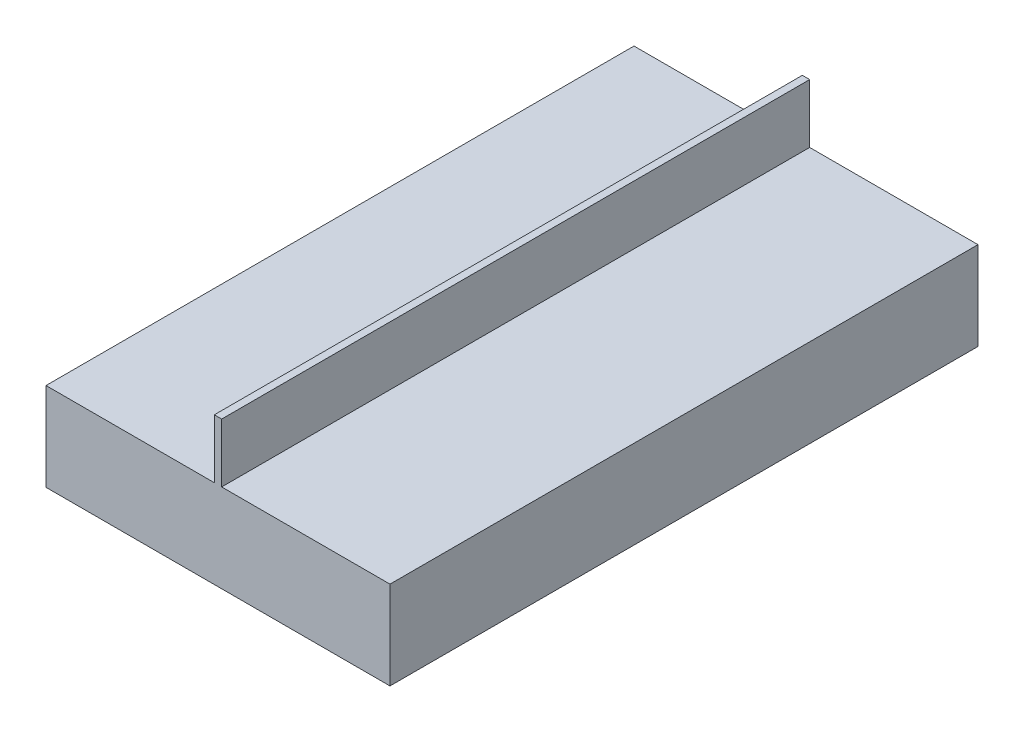
from build123d import *
from build123d.topology import SkipClean

# Parameters (mm, degrees)
BOSS_EXTRUDE1_DEPTH = 40
SKETCH2_R           = 1.5
CUT_EXTRUDE2_DEPTH  = 5
THREAD1_PITCH       = 0.8


with BuildPart() as part:
    # Sketch1 → Boss-Extrude1 (new body)
    with BuildSketch(Plane.XY):
        Polygon((-11.7, 3), (-0.25, 3), (-0.25, 7), (0.25, 7), (0.25, 3), (11.7, 3), (11.7, -3), (-11.7, -3), align=None)
    extrude(amount=BOSS_EXTRUDE1_DEPTH)

    # Sketch2 → Cut-Extrude2 (cut)
    with BuildSketch(Plane(origin=(0, 0, 0), x_dir=(-1, 0, 0), z_dir=(0, 0, -1))):
        Circle(SKETCH2_R)
    extrude(amount=-CUT_EXTRUDE2_DEPTH, mode=Mode.SUBTRACT)

    # Thread1: the profile of Thread Profile1 profile screwed along a right-hand helix of 8.75 turns, 8 arcs to a turn; built about Z, then put on its axis
    with SkipClean():  # the faces are left unmerged after this step: merging them gives an invalid solid
        thread1_z = Axis((0, 0, 0), (0, 0, 1))
        thread1_corners = [(1.4997, 0, -0.000173205), (1.9330127, 0, 0.249999999), (1.9330127, 0, 0.349999999), (1.4997, 0, 0.600173203)]
        with BuildLine(mode=Mode.PRIVATE) as thread1_profile:
            Line(thread1_corners[0], thread1_corners[1])
            Line(thread1_corners[1], thread1_corners[2])
            Line(thread1_corners[2], thread1_corners[3])
            Line(thread1_corners[3], thread1_corners[0])
        thread1_cap = Face(thread1_profile.wire())
        thread1_turn_angles = [0, 22.5, 45, 67.5, 90, 112.5, 135, 157.5, 180, 202.5, 225, 247.5, 270, 292.5, 315, 337.5, 360]
        thread1_turn_weights = [1, 0.9238795325112867, 1, 0.9238795325112867, 1, 0.9238795325112867, 1, 0.9238795325112867, 1, 0.9238795325112867, 1, 0.9238795325112867, 1, 0.9238795325112867, 1, 0.9238795325112867, 1]
        thread1_turn_rails = [Edge.make_bspline([Vector(p[0], p[1], 0).rotate(thread1_z, thread1_turn_angles[k]) / thread1_turn_weights[k] + Vector(0, 0, p[2] + THREAD1_PITCH * thread1_turn_angles[k] / 360) for k in range(17)], [0, 0, 0, 1, 1, 2, 2, 3, 3, 4, 4, 5, 5, 6, 6, 7, 7, 8, 8, 8], 2, thread1_turn_weights) for p in thread1_corners]
        thread1_turn_sides = [Face.make_surface_from_curves(thread1_turn_rails[p[0]], thread1_turn_rails[p[1]]) for p in [(0, 1), (1, 2), (2, 3), (3, 0)]]
        thread1_last_angles = [2880, 2902.5, 2925, 2947.5, 2970, 2992.5, 3015, 3037.5, 3060, 3082.5, 3105, 3127.5, 3150]
        thread1_last_weights = [1, 0.9238795325112867, 1, 0.9238795325112867, 1, 0.9238795325112867, 1, 0.9238795325112867, 1, 0.9238795325112867, 1, 0.9238795325112867, 1]
        thread1_last_rails = [Edge.make_bspline([Vector(p[0], p[1], 0).rotate(thread1_z, thread1_last_angles[k]) / thread1_last_weights[k] + Vector(0, 0, p[2] + THREAD1_PITCH * thread1_last_angles[k] / 360) for k in range(13)], [0, 0, 0, 1, 1, 2, 2, 3, 3, 4, 4, 5, 5, 6, 6, 6], 2, thread1_last_weights) for p in thread1_corners]
        thread1_last_sides = [Face.make_surface_from_curves(thread1_last_rails[p[0]], thread1_last_rails[p[1]]) for p in [(0, 1), (1, 2), (2, 3), (3, 0)]]
        thread1 = Plane(origin=(0, 0, 0), x_dir=(1, 0, 0), z_dir=(0, 0, 1)) * Solid(Shell([*[p.moved(Location((0, 0, THREAD1_PITCH * i))) for i in range(8) for p in thread1_turn_sides], *thread1_last_sides, thread1_cap, thread1_cap.rotate(thread1_z, 3150).moved(Location((0, 0, THREAD1_PITCH * 3150 / 360)))]))
        add(thread1, mode=Mode.SUBTRACT)


solid = part.part
